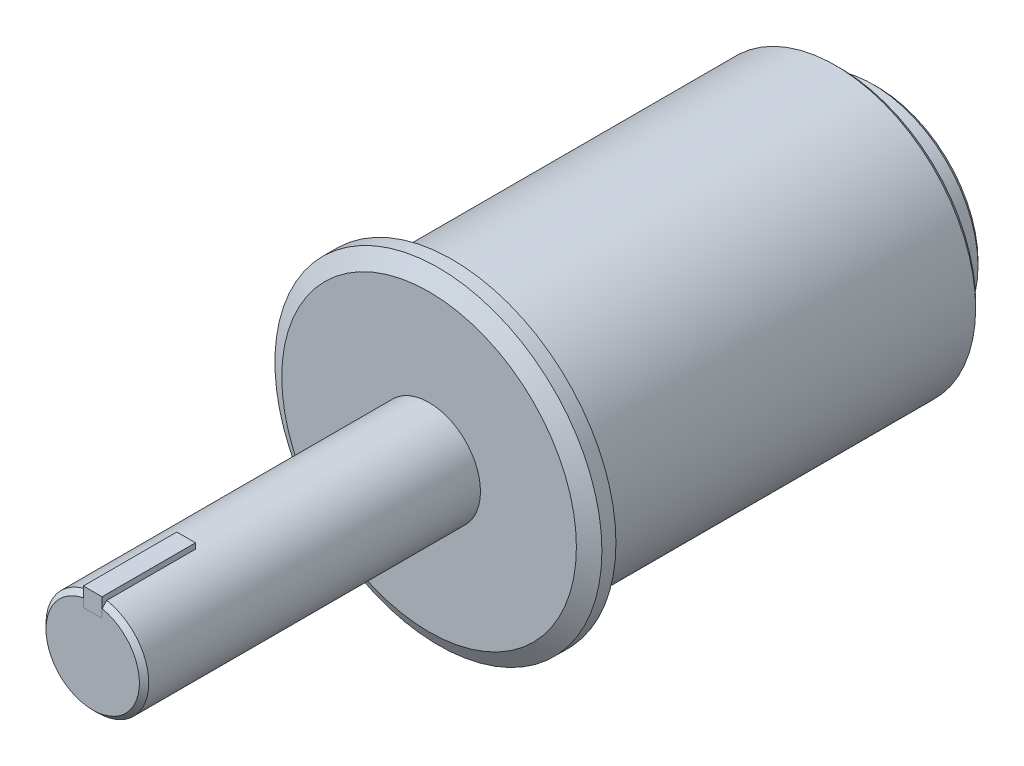
from build123d import *

# Parameters (mm, degrees)
SKETCH2_W           = 4
SKETCH2_H           = 4
CUT_EXTRUDE1_DEPTH  = 20
SKETCH2_2_W         = 4
SKETCH2_2_H         = 4
BOSS_EXTRUDE2_DEPTH = 20


with BuildPart() as part:
    # Sketch1 → Revolve1 (revolve)
    with BuildSketch(Plane(origin=(0, 0, 0), x_dir=(1, 0, 0), z_dir=(0, 1, 0))):
        Polygon((0, 0), (0, 80), (-14.5, 80), (-14.5, 168), (-21.5, 168), (-22.5, 167), (-22.5, 160), (-29, 160), (-30, 159), (-30, 77), (-35, 77), (-35, 74), (-31.535898385, 72), (-11, 72), (-11, 1), (-10, 0), align=None)
    revolve(axis=Axis((0, 0, 0), (0, 0, -1)))

    # Sketch2 → Cut-Extrude1 (cut)
    with BuildSketch(Plane.XY):
        with Locations((0, 10)):
            Rectangle(SKETCH2_W, SKETCH2_H)
    extrude(amount=-CUT_EXTRUDE1_DEPTH, mode=Mode.SUBTRACT)


with BuildPart() as body_2:
    # Sketch2<2> → Boss-Extrude2 (new body)
    with BuildSketch(Plane.XY):
        with Locations((0, 10)):
            Rectangle(SKETCH2_2_W, SKETCH2_2_H)
    extrude(amount=-BOSS_EXTRUDE2_DEPTH)


solid = Compound([part.part, body_2.part])
